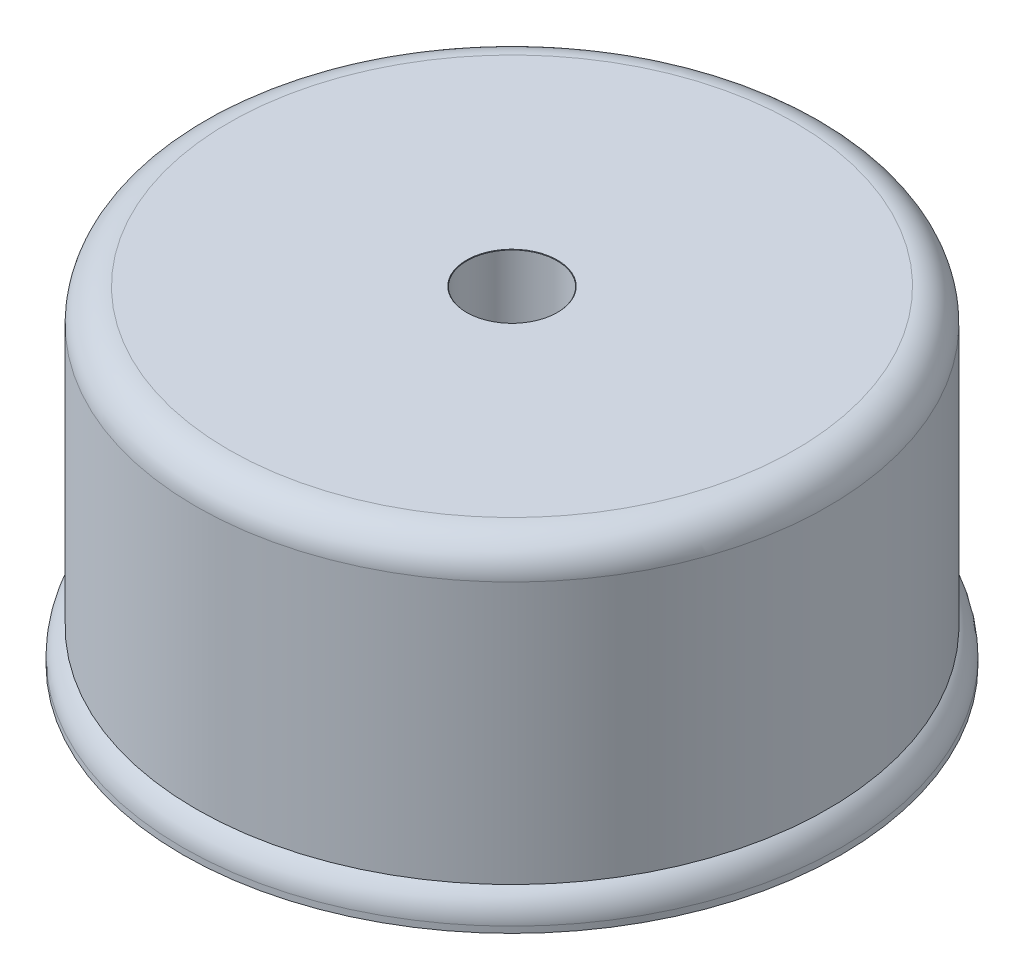
from build123d import *

# Parameters (mm, degrees)
SKETCH1_R                      = 20.125
BOSS_EXTRUDE1_DEPTH            = 20
SKETCH12_W                     = 21.496046148
SKETCH12_H                     = 21.496046148
CUT_EXTRUDE1_DEPTH             = 15
CUT_EXTRUDE2_START             = -18
SKETCH16_R                     = 20.125
SKETCH16_R_2                   = 19.3
CUT_EXTRUDE2_DEPTH             = 18
FILLET3_R                      = 2
M5_CLEARANCE_HOLE1_D           = 5.5
M5_CLEARANCE_HOLE1_CSINK_D     = 5.55
M5_CLEARANCE_HOLE1_CSINK_ANGLE = 90


with BuildPart() as part:
    # Sketch1 → Boss-Extrude1 (new body)
    with BuildSketch(Plane(origin=(0, 0, 0), x_dir=(1, 0, 0), z_dir=(0, 1, 0))):
        with Locations(Location((0, 0, 0), (0, 0, 270))):
            Circle(SKETCH1_R)
    extrude(amount=BOSS_EXTRUDE1_DEPTH)

    # Sketch12 → Cut-Extrude1 (cut)
    with BuildSketch(Plane.XZ):
        Rectangle(SKETCH12_W, SKETCH12_H)
    extrude(amount=-CUT_EXTRUDE1_DEPTH, mode=Mode.SUBTRACT)

    # Sketch16 → Cut-Extrude2 (cut)
    with BuildSketch(Plane(origin=(0, 20, 0), x_dir=(1, 0, 0), z_dir=(0, 1, 0)).offset(CUT_EXTRUDE2_START)):
        with Locations(Location((0, 0, 0), (0, 0, 270))):
            Circle(SKETCH16_R)
        with Locations(Location((0, 0, 0), (0, 0, 270))):
            Circle(SKETCH16_R_2, mode=Mode.SUBTRACT)
    extrude(amount=CUT_EXTRUDE2_DEPTH, mode=Mode.SUBTRACT)

    # Fillet3
    # the kernel refuses this fillet: 2 mm, written as the material it takes off along each edge
    with BuildSketch(Plane(origin=(0, 20, 0), x_dir=(0, 0, 1), z_dir=(-1, 0, 0))) as fillet3_piece_1:
        with BuildLine():
            CenterArc((19.3 - FILLET3_R, -FILLET3_R), FILLET3_R, 0, 90)
            Line((19.3 - FILLET3_R, 0), (19.3 - FILLET3_R, FILLET3_R * 0.02))
            Line((19.3 - FILLET3_R, FILLET3_R * 0.02), (19.3 + FILLET3_R * 0.02, FILLET3_R * 0.02))
            Line((19.3 + FILLET3_R * 0.02, FILLET3_R * 0.02), (19.3 + FILLET3_R * 0.02, -FILLET3_R))
            Line((19.3 + FILLET3_R * 0.02, -FILLET3_R), (19.3, -FILLET3_R))
        make_face()
    revolve(axis=Axis((0, 20, 0), (0, 1, 0)), mode=Mode.SUBTRACT)
    with BuildSketch(Plane(origin=(0, 2, 0), x_dir=(0, 0, 1), z_dir=(-1, 0, 0))) as fillet3_piece_2:
        with BuildLine():
            CenterArc((18.125, -1.618448331), FILLET3_R, 0, 54.020199403)
            Line((19.3, 0), (19.3235, 0.032368967))
            ThreePointArc((19.3235, 0.032368967), (19.7125, 0.04), (20.125, 0.04))
            Line((20.125, 0.04), (20.165, 0))
            Line((20.165, 0), (20.165, -1.618448331))
            Line((20.165, -1.618448331), (20.125, -1.618448331))
        make_face()
    revolve(axis=Axis((0, 2, 0), (0, 1, 0)), mode=Mode.SUBTRACT)

    # M5 Clearance Hole1 (through all)
    with Locations(Plane(origin=(0, 20, 0), x_dir=(1, 0, 0), z_dir=(0, 1, 0))):
        with Locations((0, 0)):
            CounterSinkHole(M5_CLEARANCE_HOLE1_D / 2, M5_CLEARANCE_HOLE1_CSINK_D / 2, counter_sink_angle=M5_CLEARANCE_HOLE1_CSINK_ANGLE)


solid = part.part
